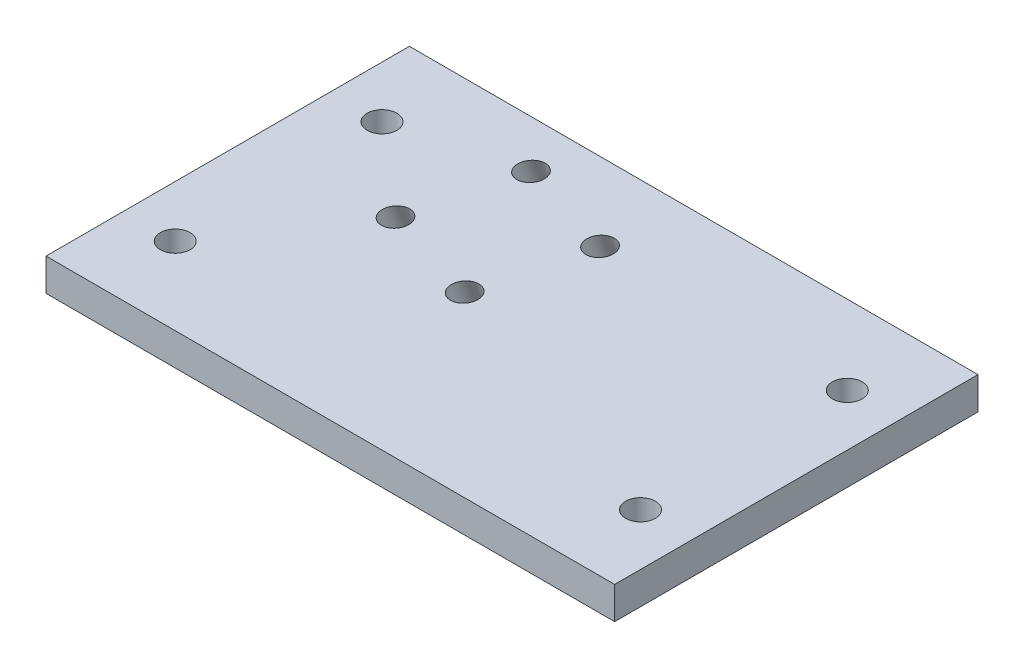
from build123d import *

# Parameters (mm, degrees)
SKETCH1_W           = 90
SKETCH1_H           = 56.23
BOSS_EXTRUDE1_DEPTH = 5
SKETCH2_R           = 2.3
CUT_EXTRUDE1_DEPTH  = 15
SKETCH6_R           = 2.03980448
CUT_EXTRUDE2_DEPTH  = 45
SKETCH7_R           = 2.3
CUT_EXTRUDE3_DEPTH  = 45
SKETCH9_W           = 61.183864123
SKETCH9_H           = 5.04390519
CUT_EXTRUDE4_DEPTH  = 2


with BuildPart() as part:
    # Sketch1 → Boss-Extrude1 (new body)
    with BuildSketch(Plane(origin=(0, 0, 0), x_dir=(1, 0, 0), z_dir=(0, 1, 0))):
        with Locations((45, 28.115)):
            Rectangle(SKETCH1_W, SKETCH1_H)
    extrude(amount=BOSS_EXTRUDE1_DEPTH)

    # Sketch2 → Cut-Extrude1 (cut)
    with BuildSketch(Plane(origin=(0, 5, 0), x_dir=(1, 0, 0), z_dir=(0, 1, 0))):
        with Locations((82, 12)):
            Circle(SKETCH2_R)
        with Locations((10, 12)):
            Circle(SKETCH2_R)
    extrude(amount=-CUT_EXTRUDE1_DEPTH, mode=Mode.SUBTRACT)

    # Sketch6 → Cut-Extrude2 (cut)
    with BuildSketch(Plane(origin=(0, 4.298349501, 1.736645926), x_dir=(1, 0, 0), z_dir=(0, 0.9271838545667871, 0.3746065934159128))):
        with Locations((28.177489427, 47.190383722)):
            Circle(SKETCH6_R)
        with Locations((23.817578468, 31.795865983)):
            Circle(SKETCH6_R)
        with Locations((39.212096207, 27.435955023)):
            Circle(SKETCH6_R)
        with Locations((43.572007167, 42.830472763)):
            Circle(SKETCH6_R)
    extrude(amount=-CUT_EXTRUDE2_DEPTH, mode=Mode.SUBTRACT)

    # Sketch7 → Cut-Extrude3 (cut)
    with BuildSketch(Plane(origin=(0, 5, 0), x_dir=(1, 0, 0), z_dir=(0, 1, 0))):
        with Locations((82, 44)):
            Circle(SKETCH7_R)
        with Locations((10, 44)):
            Circle(SKETCH7_R)
    extrude(amount=-CUT_EXTRUDE3_DEPTH, mode=Mode.SUBTRACT)

    # Sketch9 → Cut-Extrude4 (cut)
    with BuildSketch(Plane.ZY):
        with Locations((-25.638067939, 2.521952595)):
            Rectangle(SKETCH9_W, SKETCH9_H)
    extrude(amount=-CUT_EXTRUDE4_DEPTH, mode=Mode.SUBTRACT)


solid = part.part
